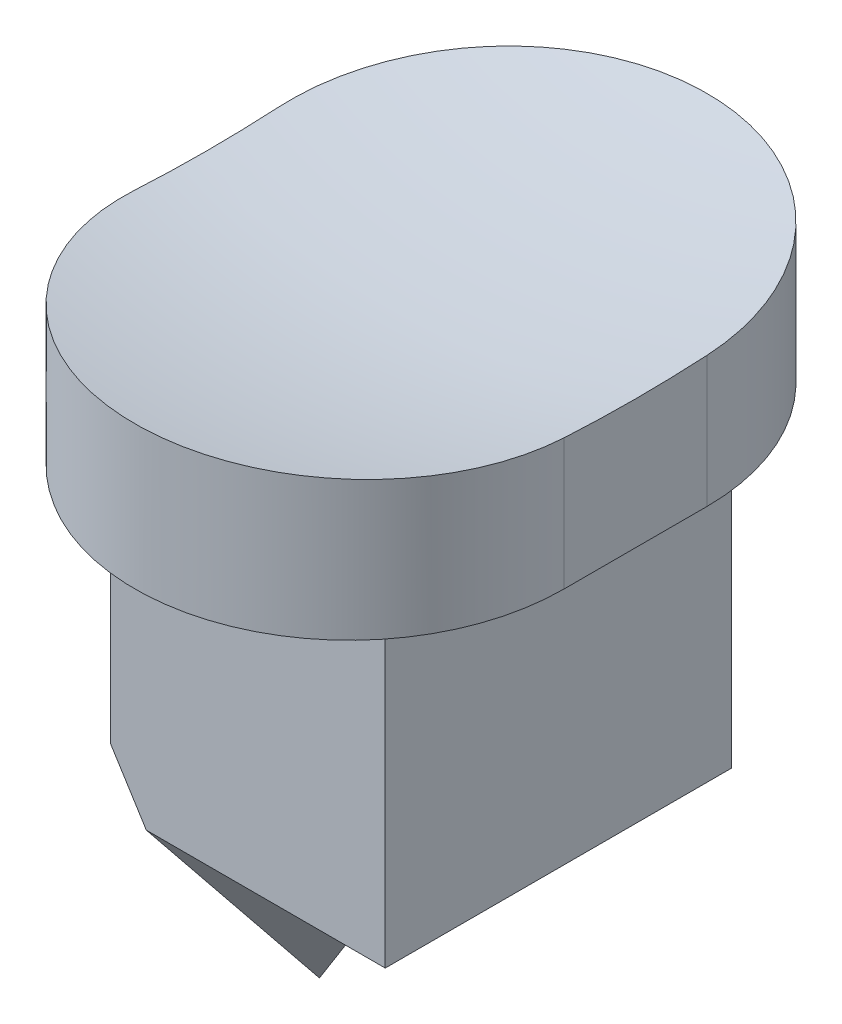
from build123d import *

# Parameters (mm, degrees)
SKETCH1_W           = 19.2
SKETCH1_H           = 24.2
BOSS_EXTRUDE1_DEPTH = 22.1
BOSS_EXTRUDE2_DEPTH = 10
BOSS_EXTRUDE3_DEPTH = 5
BOSS_EXTRUDE4_DEPTH = 1.5
CHAMFER1_SIZE       = 2.5
FILLET1_R           = 3


with BuildPart() as part:
    # Sketch1 → Boss-Extrude1 (new body)
    with BuildSketch(Plane(origin=(0, 0, 0), x_dir=(1, 0, 0), z_dir=(0, 1, 0))):
        Rectangle(SKETCH1_W, SKETCH1_H)
    extrude(amount=BOSS_EXTRUDE1_DEPTH)

    # Sketch2 → Boss-Extrude2 (add)
    with BuildSketch(Plane(origin=(0, 22.1, 0), x_dir=(1, 0, 0), z_dir=(0, 1, 0))):
        with BuildLine():
            Line((15, 5), (15, -5))
            ThreePointArc((15, -5), (0, -20), (-15, -5))
            Line((-15, -5), (-15, 5))
            ThreePointArc((-15, 5), (0, 20), (15, 5))
        make_face()
    extrude(amount=BOSS_EXTRUDE2_DEPTH)

    # Sketch4 → Boss-Extrude3 (add)
    with BuildSketch(Plane.ZY.offset(9.6)):
        Polygon((-12.1, 0), (0, -15), (12.1, 0), align=None)
    extrude(amount=-BOSS_EXTRUDE3_DEPTH)

    # Sketch6 → Boss-Extrude4 (add, symmetric)
    with BuildSketch(Plane.XY):
        Polygon((-4.6, -5), (9.6, 0), (-4.6, 0), align=None)
    extrude(amount=BOSS_EXTRUDE4_DEPTH, both=True)

    # Chamfer1
    chamfer1_edges = [part.edges().sort_by_distance(p)[0] for p in [
        (-9.6, -7.5, -6.05),
        (-4.6, -7.5, -6.05),
        (-9.6, -7.5, 6.05),
        (-4.6, -7.5, 6.05),
    ]]
    chamfer(chamfer1_edges, length=CHAMFER1_SIZE - 0.0001)  # a hair under: the kernel refuses the full size

    # Fillet1
    fillet1_edges = [part.edges().sort_by_distance(p)[0] for p in [
        (-4.6, 0, -5.194064205),
        (-4.6, 0, 5.194064205),
    ]]
    fillet(fillet1_edges, radius=FILLET1_R)

    # Sketch8 → Cut-Revolve3 (revolve, cut)
    with BuildSketch(Plane(origin=(0, 0, 0), x_dir=(0, 0, -1), z_dir=(1, 0, 0))):
        with BuildLine():
            Line((-90.14660282, 120), (90.14660282, 120))
            ThreePointArc((90.14660282, 120), (0, 29.85339718), (-90.14660282, 120))
        make_face()
    revolve(axis=Axis((0, 120, 90.14660282), (0, 0, -1)), mode=Mode.SUBTRACT)


solid = part.part
